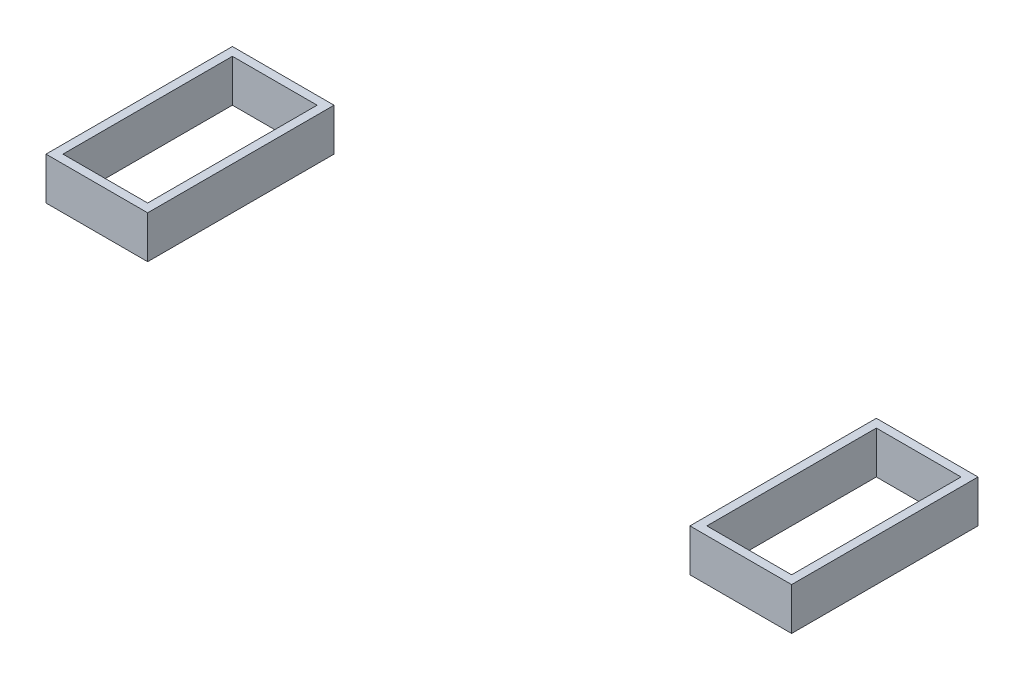
from build123d import *

# Parameters (mm, degrees)
SKETCH2_W             = 12
SKETCH2_H             = 22
SKETCH2_W_2           = 10
SKETCH2_H_2           = 20
BOSS_EXTRUDE1_DEPTH   = 5
BOSS_EXTRUDE1_2_DEPTH = 5


with BuildPart() as part:
    # Sketch2 → Boss-Extrude1 (new body)
    with BuildSketch(Plane(origin=(0, 60, 0), x_dir=(1, 0, 0), z_dir=(0, 1, 0))):
        with Locations((-38, -50)):
            Rectangle(SKETCH2_W, SKETCH2_H)
        with Locations((-38, -50)):
            Rectangle(SKETCH2_W_2, SKETCH2_H_2, mode=Mode.SUBTRACT)
    extrude(amount=BOSS_EXTRUDE1_DEPTH)


with BuildPart() as body_2:
    # Sketch2 → Boss-Extrude1 2 (new body)
    with BuildSketch(Plane(origin=(0, 60, 0), x_dir=(1, 0, 0), z_dir=(0, 1, 0))):
        with Locations((38, -50)):
            Rectangle(SKETCH2_W, SKETCH2_H)
        with Locations((38, -50)):
            Rectangle(SKETCH2_W_2, SKETCH2_H_2, mode=Mode.SUBTRACT)
    extrude(amount=BOSS_EXTRUDE1_2_DEPTH)


solid = Compound([part.part, body_2.part])
